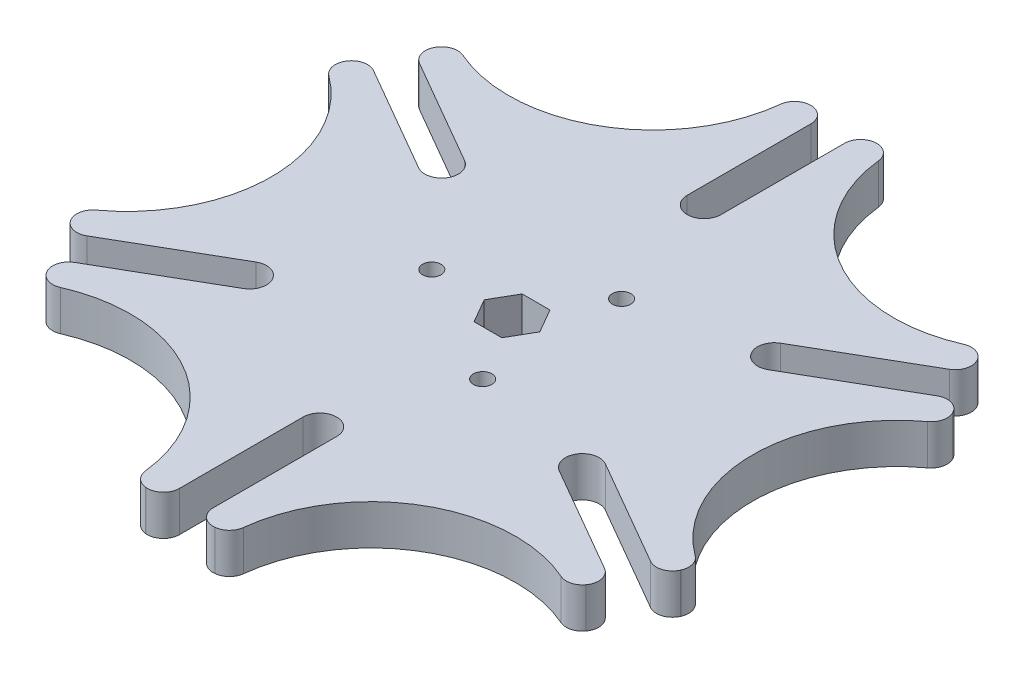
from build123d import *

# Parameters (mm, degrees)
SKETCH10_R          = 1.15
BOSS_EXTRUDE7_DEPTH = 5
FILLET1_R           = 2


with BuildPart() as part:
    # Sketch10 → Boss-Extrude7 (new body)
    with BuildSketch(Plane(origin=(0, 0, 0), x_dir=(1, 0, 0), z_dir=(0, 1, 0))):
        with BuildLine():
            ThreePointArc((21.788642844, 10.154807681), (18.919989496, 10.923461029), (19.688642844, 13.792114377))
            Line((19.688642844, 13.792114377), (34.904033153, 22.576724068))
            ThreePointArc((34.904033153, 22.576724068), (33.799543938, 24.198984061), (32.619717262, 25.767305753))
            ThreePointArc((32.619717262, 25.767305753), (15, 25.980762114), (6.005282738, 41.133156689))
            ThreePointArc((6.005282738, 41.133156689), (4.057162974, 41.370755717), (2.1, 41.516141439))
            Line((2.1, 41.516141439), (2.1, 23.946922058))
            ThreePointArc((2.1, 23.946922058), (0, 21.846922058), (-2.1, 23.946922058))
            Line((-2.1, 23.946922058), (-2.1, 41.516141439))
            ThreePointArc((-2.1, 41.516141439), (-4.057162974, 41.370755717), (-6.005282738, 41.133156689))
            ThreePointArc((-6.005282738, 41.133156689), (-15, 25.980762114), (-32.619717262, 25.767305753))
            ThreePointArc((-32.619717262, 25.767305753), (-33.799543938, 24.198984061), (-34.904033153, 22.576724068))
            Line((-34.904033153, 22.576724068), (-19.688642844, 13.792114377))
            ThreePointArc((-19.688642844, 13.792114377), (-18.919989496, 10.923461029), (-21.788642844, 10.154807681))
            Line((-21.788642844, 10.154807681), (-37.004033153, 18.939417372))
            ThreePointArc((-37.004033153, 18.939417372), (-37.856706912, 17.171771656), (-38.625, 15.365850936))
            ThreePointArc((-38.625, 15.365850936), (-30, 0), (-38.625, -15.365850936))
            ThreePointArc((-38.625, -15.365850936), (-37.856706912, -17.171771656), (-37.004033153, -18.939417372))
            Line((-37.004033153, -18.939417372), (-21.788642844, -10.154807681))
            ThreePointArc((-21.788642844, -10.154807681), (-18.919989496, -10.923461029), (-19.688642844, -13.792114377))
            Line((-19.688642844, -13.792114377), (-34.904033153, -22.576724068))
            ThreePointArc((-34.904033153, -22.576724068), (-33.799543938, -24.198984061), (-32.619717262, -25.767305753))
            ThreePointArc((-32.619717262, -25.767305753), (-15, -25.980762114), (-6.005282738, -41.133156689))
            ThreePointArc((-6.005282738, -41.133156689), (-4.057162974, -41.370755717), (-2.1, -41.516141439))
            Line((-2.1, -41.516141439), (-2.1, -23.946922058))
            ThreePointArc((-2.1, -23.946922058), (0, -21.846922058), (2.1, -23.946922058))
            Line((2.1, -23.946922058), (2.1, -41.516141439))
            ThreePointArc((2.1, -41.516141439), (4.057162974, -41.370755717), (6.005282738, -41.133156689))
            ThreePointArc((6.005282738, -41.133156689), (15, -25.980762114), (32.619717262, -25.767305753))
            ThreePointArc((32.619717262, -25.767305753), (33.799543938, -24.198984061), (34.904033153, -22.576724068))
            Line((34.904033153, -22.576724068), (19.688642844, -13.792114377))
            ThreePointArc((19.688642844, -13.792114377), (18.919989496, -10.923461029), (21.788642844, -10.154807681))
            Line((21.788642844, -10.154807681), (37.004033153, -18.939417372))
            ThreePointArc((37.004033153, -18.939417372), (37.856706912, -17.171771656), (38.625, -15.365850936))
            ThreePointArc((38.625, -15.365850936), (30, 0), (38.625, 15.365850936))
            ThreePointArc((38.625, 15.365850936), (37.856706912, 17.171771656), (37.004033153, 18.939417372))
            Line((37.004033153, 18.939417372), (21.788642844, 10.154807681))
        make_face()
        Polygon((3.464101615, 0), (1.732050808, -3), (-1.732050808, -3), (-3.464101615, 0), (-1.732050808, 3), (1.732050808, 3), align=None, mode=Mode.SUBTRACT)
        with Locations((5, -8.660254038)):
            Circle(SKETCH10_R, mode=Mode.SUBTRACT)
        with Locations((-10, 0)):
            Circle(SKETCH10_R, mode=Mode.SUBTRACT)
        with Locations((5, 8.660254038)):
            Circle(SKETCH10_R, mode=Mode.SUBTRACT)
    extrude(amount=BOSS_EXTRUDE7_DEPTH)

    # Fillet1
    fillet1_edges = [part.edges().sort_by_distance(p)[0] for p in [
        (-6.005282738, 2.5, -41.133156689),
        (6.005282738, 2.5, -41.133156689),
        (2.1, 2.5, -41.516141439),
        (-2.1, 2.5, -41.516141439),
        (32.619717262, 2.5, -25.767305753),
        (34.904033153, 2.5, -22.576724068),
        (37.004033153, 2.5, -18.939417372),
        (38.625, 2.5, -15.365850936),
        (38.625, 2.5, 15.365850936),
        (37.004033153, 2.5, 18.939417372),
        (34.904033153, 2.5, 22.576724068),
        (32.619717262, 2.5, 25.767305753),
        (2.1, 2.5, 41.516141439),
        (6.005282738, 2.5, 41.133156689),
        (-2.1, 2.5, 41.516141439),
        (-6.005282738, 2.5, 41.133156689),
        (-32.619717262, 2.5, 25.767305753),
        (-34.904033153, 2.5, 22.576724068),
        (-38.625, 2.5, 15.365850936),
        (-37.004033153, 2.5, 18.939417372),
        (-37.004033153, 2.5, -18.939417372),
        (-38.625, 2.5, -15.365850936),
        (-34.904033153, 2.5, -22.576724068),
        (-32.619717262, 2.5, -25.767305753),
    ]]
    fillet(fillet1_edges, radius=FILLET1_R)


solid = part.part
